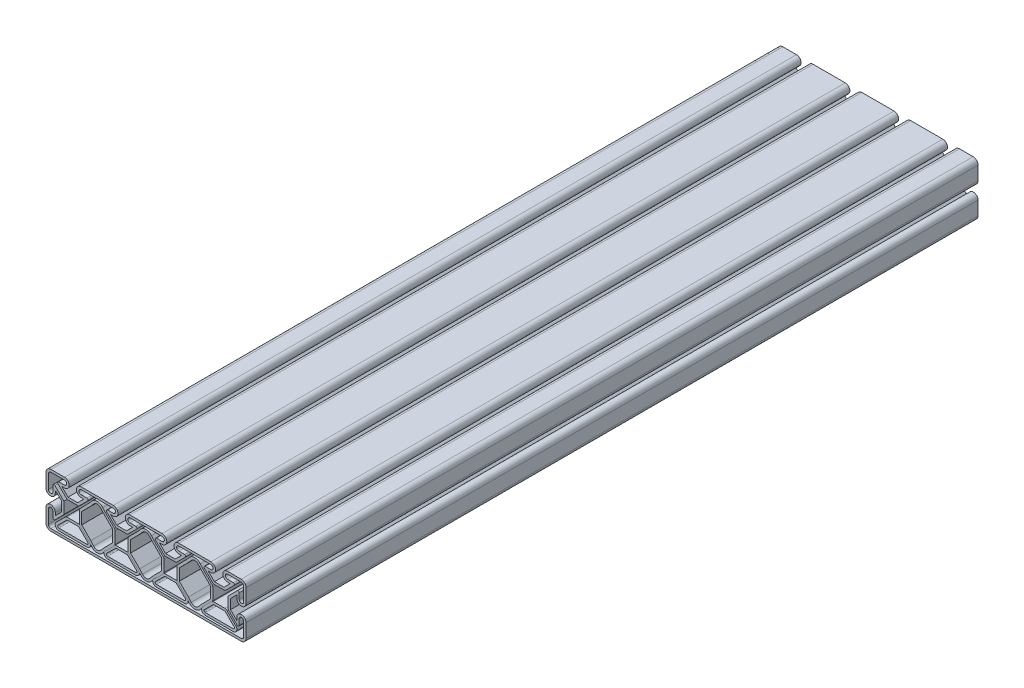
from build123d import *

# Parameters (mm, degrees)
EXTRUIR_L_MINA3_DEPTH   = 300
EXTRUIR_L_MINA3_2_DEPTH = 300
EXTRUIR_L_MINA3_3_DEPTH = 300
EXTRUIR_L_MINA3_4_DEPTH = 300
EXTRUIR_L_MINA3_5_DEPTH = 300
EXTRUIR_L_MINA3_6_DEPTH = 300
EXTRUIR_L_MINA3_7_DEPTH = 300
EXTRUIR_L_MINA3_8_DEPTH = 300


with BuildPart() as part:
    # Croquis1 → Extruir-Lámina3 (new body)
    with BuildSketch(Plane.XY.offset(50)):
        with BuildLine():
            Line((3.317284325, -6.768847378), (2.192426312, -8.056279027))
            ThreePointArc((2.192426312, -8.056279027), (-0.056796543, -9.115123728), (-2.284563012, -8.011850366))
            Line((-2.284563012, -8.011850366), (-3.391818467, -6.779379888))
            ThreePointArc((-3.391818467, -6.779379888), (-3.398431113, -6.772867398), (-3.405003337, -6.766314118))
            Line((-3.405003337, -6.766314118), (-7.166930022, -2.974891232))
            ThreePointArc((-7.166930022, -2.974891232), (-7.334651994, -2.659705848), (-7.392594033, -2.307405967))
            Line((-7.392594033, -2.307405967), (-7.392594033, 2.392594033))
            ThreePointArc((-7.392594033, 2.392594033), (-7.334651994, 2.744893913), (-7.166930022, 3.060079297))
            Line((-7.166930022, 3.060079297), (-3.405003337, 6.851502183))
            ThreePointArc((-3.405003337, 6.851502183), (-3.403738619, 6.852769568), (-3.40247239, 6.854035443))
            Line((-3.40247239, 6.854035443), (-2.277614377, 8.141467092))
            ThreePointArc((-2.277614377, 8.141467092), (-0.028391522, 9.200311794), (2.199374946, 8.097038431))
            Line((2.199374946, 8.097038431), (3.306630402, 6.864567953))
            ThreePointArc((3.306630402, 6.864567953), (3.313243048, 6.858055463), (3.319815271, 6.851502183))
            Line((3.319815271, 6.851502183), (7.081741956, 3.060079297))
            ThreePointArc((7.081741956, 3.060079297), (7.249463928, 2.744893913), (7.307405967, 2.392594033))
            Line((7.307405967, 2.392594033), (7.307405967, -2.307405967))
            ThreePointArc((7.307405967, -2.307405967), (7.249463928, -2.659705848), (7.081741956, -2.974891232))
            Line((7.081741956, -2.974891232), (3.319815271, -6.766314118))
            ThreePointArc((3.319815271, -6.766314118), (3.318550554, -6.767581503), (3.317284325, -6.768847378))
        make_face()
        with BuildLine():
            Line((2.592630975, -6.078383317), (1.425820625, -7.413830597))
            ThreePointArc((1.425820625, -7.413830597), (-0.054396167, -8.115083079), (-1.514441587, -7.372746117))
            Line((-1.514441587, -7.372746117), (-2.675150448, -6.080777405))
            ThreePointArc((-2.675150448, -6.080777405), (-2.685792015, -6.071019973), (-2.696147423, -6.060959358))
            Line((-2.696147423, -6.060959358), (-6.386563295, -2.341607982))
            ThreePointArc((-6.386563295, -2.341607982), (-6.391074808, -2.324770785), (-6.392594033, -2.307405967))
            Line((-6.392594033, -2.307405967), (-6.392594033, 2.392594033))
            ThreePointArc((-6.392594033, 2.392594033), (-6.391074808, 2.40995885), (-6.386563295, 2.426796047))
            Line((-6.386563295, 2.426796047), (-2.696147423, 6.146147423))
            ThreePointArc((-2.696147423, 6.146147423), (-2.687093407, 6.154975297), (-2.67781904, 6.163571383))
            Line((-2.67781904, 6.163571383), (-1.51100869, 7.499018663))
            ThreePointArc((-1.51100869, 7.499018663), (-0.030791898, 8.200271144), (1.429253522, 7.457934182))
            Line((1.429253522, 7.457934182), (2.589962383, 6.16596547))
            ThreePointArc((2.589962383, 6.16596547), (2.60060395, 6.156208038), (2.610959358, 6.146147423))
            Line((2.610959358, 6.146147423), (6.301375229, 2.426796047))
            ThreePointArc((6.301375229, 2.426796047), (6.305886743, 2.40995885), (6.307405967, 2.392594033))
            Line((6.307405967, 2.392594033), (6.307405967, -2.307405967))
            ThreePointArc((6.307405967, -2.307405967), (6.305886743, -2.324770785), (6.301375229, -2.341607982))
            Line((6.301375229, -2.341607982), (2.610959358, -6.060959358))
            ThreePointArc((2.610959358, -6.060959358), (2.601905342, -6.069787232), (2.592630975, -6.078383317))
        make_face(mode=Mode.SUBTRACT)
    extrude(amount=EXTRUIR_L_MINA3_DEPTH)


with BuildPart() as body_2:
    # Croquis1 → Extruir-L_mina3 2 (new body)
    with BuildSketch(Plane.XY.offset(50)):
        with BuildLine():
            Line((5.421326573, 7.242594033), (6.557405967, 7.242594033))
            ThreePointArc((6.557405967, 7.242594033), (8.457405967, 9.142594033), (6.557405967, 11.042594033))
            Line((6.557405967, 11.042594033), (-6.642594033, 11.042594033))
            ThreePointArc((-6.642594033, 11.042594033), (-8.542594033, 9.142594033), (-6.642594033, 7.242594033))
            Line((-6.642594033, 7.242594033), (-5.506514638, 7.242594033))
            Line((-5.506514638, 7.242594033), (-8.076837601, 4.692594033))
            Line((-8.076837601, 4.692594033), (-12.008350464, 4.692594033))
            Line((-12.008350464, 4.692594033), (-14.578673427, 7.242594033))
            Line((-14.578673427, 7.242594033), (-13.442594033, 7.242594033))
            ThreePointArc((-13.442594033, 7.242594033), (-11.542594033, 9.142594033), (-13.442594033, 11.042594033))
            Line((-13.442594033, 11.042594033), (-26.642594033, 11.042594033))
            ThreePointArc((-26.642594033, 11.042594033), (-28.542594033, 9.142594033), (-26.642594033, 7.242594033))
            Line((-26.642594033, 7.242594033), (-25.506514638, 7.242594033))
            Line((-25.506514638, 7.242594033), (-28.076837601, 4.692594033))
            Line((-28.076837601, 4.692594033), (-32.008350464, 4.692594033))
            Line((-32.008350464, 4.692594033), (-34.578673427, 7.242594033))
            Line((-34.578673427, 7.242594033), (-33.442594033, 7.242594033))
            ThreePointArc((-33.442594033, 7.242594033), (-31.542594033, 9.142594033), (-33.442594033, 11.042594033))
            Line((-33.442594033, 11.042594033), (-39.042594033, 11.042594033))
            ThreePointArc((-39.042594033, 11.042594033), (-40.456807595, 10.456807595), (-41.042594033, 9.042594033))
            Line((-41.042594033, 9.042594033), (-41.042594033, 3.442594033))
            ThreePointArc((-41.042594033, 3.442594033), (-39.142594033, 1.542594033), (-37.242594033, 3.442594033))
            Line((-37.242594033, 3.442594033), (-37.242594033, 4.578783956))
            Line((-37.242594033, 4.578783956), (-34.692594033, 2.008790129))
            Line((-34.692594033, 2.008790129), (-34.692594033, -1.923602064))
            Line((-34.692594033, -1.923602064), (-37.242594033, -4.493595891))
            Line((-37.242594033, -4.493595891), (-37.242594033, -3.357405967))
            ThreePointArc((-37.242594033, -3.357405967), (-39.142594033, -1.457405967), (-41.042594033, -3.357405967))
            Line((-41.042594033, -3.357405967), (-41.042594033, -8.957405967))
            ThreePointArc((-41.042594033, -8.957405967), (-40.456807595, -10.37161953), (-39.042594033, -10.957405967))
            Line((-39.042594033, -10.957405967), (-33.442594033, -10.957405967))
            Line((-33.442594033, -10.957405967), (-26.642594033, -10.957405967))
            Line((-26.642594033, -10.957405967), (-13.442594033, -10.957405967))
            Line((-13.442594033, -10.957405967), (-6.642594033, -10.957405967))
            Line((-6.642594033, -10.957405967), (6.557405967, -10.957405967))
            Line((6.557405967, -10.957405967), (13.357405967, -10.957405967))
            Line((13.357405967, -10.957405967), (26.557405967, -10.957405967))
            Line((26.557405967, -10.957405967), (33.357405967, -10.957405967))
            Line((33.357405967, -10.957405967), (38.957405967, -10.957405967))
            ThreePointArc((38.957405967, -10.957405967), (40.37161953, -10.37161953), (40.957405967, -8.957405967))
            Line((40.957405967, -8.957405967), (40.957405967, -3.357405967))
            ThreePointArc((40.957405967, -3.357405967), (39.057405967, -1.457405967), (37.157405967, -3.357405967))
            Line((37.157405967, -3.357405967), (37.157405967, -4.493595891))
            Line((37.157405967, -4.493595891), (34.607405967, -1.923602064))
            Line((34.607405967, -1.923602064), (34.607405967, 2.008790129))
            Line((34.607405967, 2.008790129), (37.157405967, 4.578783956))
            Line((37.157405967, 4.578783956), (37.157405967, 3.442594033))
            ThreePointArc((37.157405967, 3.442594033), (39.057405967, 1.542594033), (40.957405967, 3.442594033))
            Line((40.957405967, 3.442594033), (40.957405967, 9.042594033))
            ThreePointArc((40.957405967, 9.042594033), (40.37161953, 10.456807595), (38.957405967, 11.042594033))
            Line((38.957405967, 11.042594033), (33.357405967, 11.042594033))
            ThreePointArc((33.357405967, 11.042594033), (31.457405967, 9.142594033), (33.357405967, 7.242594033))
            Line((33.357405967, 7.242594033), (34.493485362, 7.242594033))
            Line((34.493485362, 7.242594033), (31.923162399, 4.692594033))
            Line((31.923162399, 4.692594033), (27.991649536, 4.692594033))
            Line((27.991649536, 4.692594033), (25.421326573, 7.242594033))
            Line((25.421326573, 7.242594033), (26.557405967, 7.242594033))
            ThreePointArc((26.557405967, 7.242594033), (28.457405967, 9.142594033), (26.557405967, 11.042594033))
            Line((26.557405967, 11.042594033), (13.357405967, 11.042594033))
            ThreePointArc((13.357405967, 11.042594033), (11.457405967, 9.142594033), (13.357405967, 7.242594033))
            Line((13.357405967, 7.242594033), (14.493485362, 7.242594033))
            Line((14.493485362, 7.242594033), (11.923162399, 4.692594033))
            Line((11.923162399, 4.692594033), (7.991649536, 4.692594033))
            Line((7.991649536, 4.692594033), (5.421326573, 7.242594033))
        make_face()
        with BuildLine():
            Line((4.207405967, 8.242594033), (6.557405967, 8.242594033))
            ThreePointArc((6.557405967, 8.242594033), (7.457405967, 9.142594033), (6.557405967, 10.042594033))
            Line((6.557405967, 10.042594033), (-6.642594033, 10.042594033))
            ThreePointArc((-6.642594033, 10.042594033), (-7.542594033, 9.142594033), (-6.642594033, 8.242594033))
            Line((-6.642594033, 8.242594033), (-4.292594033, 8.242594033))
            ThreePointArc((-4.292594033, 8.242594033), (-3.830654266, 7.933935749), (-3.939040642, 7.389040642))
            Line((-3.939040642, 7.389040642), (-7.598624771, 3.758392018))
            ThreePointArc((-7.598624771, 3.758392018), (-7.635236389, 3.710678828), (-7.692594033, 3.692594033))
            Line((-7.692594033, 3.692594033), (-12.392594033, 3.692594033))
            ThreePointArc((-12.392594033, 3.692594033), (-12.449951676, 3.710678828), (-12.486563295, 3.758392018))
            Line((-12.486563295, 3.758392018), (-16.146147423, 7.389040642))
            ThreePointArc((-16.146147423, 7.389040642), (-16.254533799, 7.933935749), (-15.792594033, 8.242594033))
            Line((-15.792594033, 8.242594033), (-13.442594033, 8.242594033))
            ThreePointArc((-13.442594033, 8.242594033), (-12.542594033, 9.142594033), (-13.442594033, 10.042594033))
            Line((-13.442594033, 10.042594033), (-26.642594033, 10.042594033))
            ThreePointArc((-26.642594033, 10.042594033), (-27.542594033, 9.142594033), (-26.642594033, 8.242594033))
            Line((-26.642594033, 8.242594033), (-24.292594033, 8.242594033))
            ThreePointArc((-24.292594033, 8.242594033), (-23.830654266, 7.933935749), (-23.939040642, 7.389040642))
            Line((-23.939040642, 7.389040642), (-27.598624771, 3.758392018))
            ThreePointArc((-27.598624771, 3.758392018), (-27.635236389, 3.710678828), (-27.692594033, 3.692594033))
            Line((-27.692594033, 3.692594033), (-32.392594033, 3.692594033))
            ThreePointArc((-32.392594033, 3.692594033), (-32.449951676, 3.710678828), (-32.486563295, 3.758392018))
            Line((-32.486563295, 3.758392018), (-36.146147423, 7.389040642))
            ThreePointArc((-36.146147423, 7.389040642), (-36.254533799, 7.933935749), (-35.792594033, 8.242594033))
            Line((-35.792594033, 8.242594033), (-33.442594033, 8.242594033))
            ThreePointArc((-33.442594033, 8.242594033), (-32.542594033, 9.142594033), (-33.442594033, 10.042594033))
            Line((-33.442594033, 10.042594033), (-39.042594033, 10.042594033))
            ThreePointArc((-39.042594033, 10.042594033), (-39.749700814, 9.749700814), (-40.042594033, 9.042594033))
            Line((-40.042594033, 9.042594033), (-40.042594033, 3.442594033))
            ThreePointArc((-40.042594033, 3.442594033), (-39.142594033, 2.542594033), (-38.242594033, 3.442594033))
            Line((-38.242594033, 3.442594033), (-38.242594033, 5.792594033))
            ThreePointArc((-38.242594033, 5.792594033), (-37.933935749, 6.254533799), (-37.389040642, 6.146147423))
            Line((-37.389040642, 6.146147423), (-33.698624771, 2.426796047))
            ThreePointArc((-33.698624771, 2.426796047), (-33.694113257, 2.40995885), (-33.692594033, 2.392594033))
            Line((-33.692594033, 2.392594033), (-33.692594033, -2.307405967))
            ThreePointArc((-33.692594033, -2.307405967), (-33.694113257, -2.324770785), (-33.698624771, -2.341607982))
            Line((-33.698624771, -2.341607982), (-37.389040642, -6.060959358))
            ThreePointArc((-37.389040642, -6.060959358), (-37.933935749, -6.169345734), (-38.242594033, -5.707405967))
            Line((-38.242594033, -5.707405967), (-38.242594033, -3.357405967))
            ThreePointArc((-38.242594033, -3.357405967), (-39.142594033, -2.457405967), (-40.042594033, -3.357405967))
            Line((-40.042594033, -3.357405967), (-40.042594033, -8.957405967))
            ThreePointArc((-40.042594033, -8.957405967), (-39.749700814, -9.664512749), (-39.042594033, -9.957405967))
            Line((-39.042594033, -9.957405967), (-33.442594033, -9.957405967))
            Line((-33.442594033, -9.957405967), (-26.642594033, -9.957405967))
            Line((-26.642594033, -9.957405967), (-13.442594033, -9.957405967))
            Line((-13.442594033, -9.957405967), (-6.642594033, -9.957405967))
            Line((-6.642594033, -9.957405967), (6.557405967, -9.957405967))
            Line((6.557405967, -9.957405967), (13.357405967, -9.957405967))
            Line((13.357405967, -9.957405967), (26.557405967, -9.957405967))
            Line((26.557405967, -9.957405967), (33.357405967, -9.957405967))
            Line((33.357405967, -9.957405967), (38.957405967, -9.957405967))
            ThreePointArc((38.957405967, -9.957405967), (39.664512749, -9.664512749), (39.957405967, -8.957405967))
            Line((39.957405967, -8.957405967), (39.957405967, -3.357405967))
            ThreePointArc((39.957405967, -3.357405967), (39.057405967, -2.457405967), (38.157405967, -3.357405967))
            Line((38.157405967, -3.357405967), (38.157405967, -5.707405967))
            ThreePointArc((38.157405967, -5.707405967), (37.848747684, -6.169345734), (37.303852577, -6.060959358))
            Line((37.303852577, -6.060959358), (33.613436705, -2.341607982))
            ThreePointArc((33.613436705, -2.341607982), (33.608925192, -2.324770785), (33.607405967, -2.307405967))
            Line((33.607405967, -2.307405967), (33.607405967, 2.392594033))
            ThreePointArc((33.607405967, 2.392594033), (33.608925192, 2.40995885), (33.613436705, 2.426796047))
            Line((33.613436705, 2.426796047), (37.303852577, 6.146147423))
            ThreePointArc((37.303852577, 6.146147423), (37.848747684, 6.254533799), (38.157405967, 5.792594033))
            Line((38.157405967, 5.792594033), (38.157405967, 3.442594033))
            ThreePointArc((38.157405967, 3.442594033), (39.057405967, 2.542594033), (39.957405967, 3.442594033))
            Line((39.957405967, 3.442594033), (39.957405967, 9.042594033))
            ThreePointArc((39.957405967, 9.042594033), (39.664512749, 9.749700814), (38.957405967, 10.042594033))
            Line((38.957405967, 10.042594033), (33.357405967, 10.042594033))
            ThreePointArc((33.357405967, 10.042594033), (32.457405967, 9.142594033), (33.357405967, 8.242594033))
            Line((33.357405967, 8.242594033), (35.707405967, 8.242594033))
            ThreePointArc((35.707405967, 8.242594033), (36.169345734, 7.933935749), (36.060959358, 7.389040642))
            Line((36.060959358, 7.389040642), (32.401375229, 3.758392018))
            ThreePointArc((32.401375229, 3.758392018), (32.364763611, 3.710678828), (32.307405967, 3.692594033))
            Line((32.307405967, 3.692594033), (27.607405967, 3.692594033))
            ThreePointArc((27.607405967, 3.692594033), (27.550048324, 3.710678828), (27.513436705, 3.758392018))
            Line((27.513436705, 3.758392018), (23.853852577, 7.389040642))
            ThreePointArc((23.853852577, 7.389040642), (23.745466201, 7.933935749), (24.207405967, 8.242594033))
            Line((24.207405967, 8.242594033), (26.557405967, 8.242594033))
            ThreePointArc((26.557405967, 8.242594033), (27.457405967, 9.142594033), (26.557405967, 10.042594033))
            Line((26.557405967, 10.042594033), (13.357405967, 10.042594033))
            ThreePointArc((13.357405967, 10.042594033), (12.457405967, 9.142594033), (13.357405967, 8.242594033))
            Line((13.357405967, 8.242594033), (15.707405967, 8.242594033))
            ThreePointArc((15.707405967, 8.242594033), (16.169345734, 7.933935749), (16.060959358, 7.389040642))
            Line((16.060959358, 7.389040642), (12.401375229, 3.758392018))
            ThreePointArc((12.401375229, 3.758392018), (12.364763611, 3.710678828), (12.307405967, 3.692594033))
            Line((12.307405967, 3.692594033), (7.607405967, 3.692594033))
            ThreePointArc((7.607405967, 3.692594033), (7.550048324, 3.710678828), (7.513436705, 3.758392018))
            Line((7.513436705, 3.758392018), (3.853852577, 7.389040642))
            ThreePointArc((3.853852577, 7.389040642), (3.745466201, 7.933935749), (4.207405967, 8.242594033))
        make_face(mode=Mode.SUBTRACT)
    extrude(amount=EXTRUIR_L_MINA3_2_DEPTH)


with BuildPart() as body_3:
    # Croquis1 → Extruir-L_mina3 3 (new body)
    with BuildSketch(Plane.XY.offset(50)):
        with BuildLine():
            Line((-24.292594033, -9.157405967), (-26.642594033, -9.157405967))
            Line((-26.642594033, -9.157405967), (-33.442594033, -9.157405967))
            Line((-33.442594033, -9.157405967), (-35.792594033, -9.157405967))
            ThreePointArc((-35.792594033, -9.157405967), (-37.178894314, -8.230268543), (-36.851473432, -6.594968008))
            Line((-36.851473432, -6.594968008), (-33.263211162, -3.035077316))
            ThreePointArc((-33.263211162, -3.035077316), (-32.877588097, -2.720096108), (-32.392594033, -2.607405967))
            Line((-32.392594033, -2.607405967), (-27.692594033, -2.607405967))
            ThreePointArc((-27.692594033, -2.607405967), (-27.207599969, -2.720096108), (-26.821976904, -3.035077316))
            Line((-26.821976904, -3.035077316), (-23.233714633, -6.594968008))
            ThreePointArc((-23.233714633, -6.594968008), (-22.906293751, -8.230268543), (-24.292594033, -9.157405967))
        make_face()
        with BuildLine():
            Line((-24.292594033, -8.157405967), (-26.642594033, -8.157405967))
            Line((-26.642594033, -8.157405967), (-33.442594033, -8.157405967))
            Line((-33.442594033, -8.157405967), (-35.792594033, -8.157405967))
            ThreePointArc((-35.792594033, -8.157405967), (-36.254533799, -7.848747684), (-36.146147423, -7.303852577))
            Line((-36.146147423, -7.303852577), (-32.486563295, -3.673203953))
            ThreePointArc((-32.486563295, -3.673203953), (-32.449951676, -3.625490763), (-32.392594033, -3.607405967))
            Line((-32.392594033, -3.607405967), (-27.692594033, -3.607405967))
            ThreePointArc((-27.692594033, -3.607405967), (-27.635236389, -3.625490763), (-27.598624771, -3.673203953))
            Line((-27.598624771, -3.673203953), (-23.939040642, -7.303852577))
            ThreePointArc((-23.939040642, -7.303852577), (-23.830654266, -7.848747684), (-24.292594033, -8.157405967))
        make_face(mode=Mode.SUBTRACT)
    extrude(amount=EXTRUIR_L_MINA3_3_DEPTH)


with BuildPart() as body_4:
    # Croquis1 → Extruir-L_mina3 4 (new body)
    with BuildSketch(Plane.XY.offset(50)):
        with BuildLine():
            Line((-4.292594033, -9.157405967), (-6.642594033, -9.157405967))
            Line((-6.642594033, -9.157405967), (-13.442594033, -9.157405967))
            Line((-13.442594033, -9.157405967), (-15.792594033, -9.157405967))
            ThreePointArc((-15.792594033, -9.157405967), (-17.178894314, -8.230268543), (-16.851473432, -6.594968008))
            Line((-16.851473432, -6.594968008), (-13.263211162, -3.035077316))
            ThreePointArc((-13.263211162, -3.035077316), (-12.877588097, -2.720096108), (-12.392594033, -2.607405967))
            Line((-12.392594033, -2.607405967), (-7.692594033, -2.607405967))
            ThreePointArc((-7.692594033, -2.607405967), (-7.207599969, -2.720096108), (-6.821976904, -3.035077316))
            Line((-6.821976904, -3.035077316), (-3.233714633, -6.594968008))
            ThreePointArc((-3.233714633, -6.594968008), (-2.906293751, -8.230268543), (-4.292594033, -9.157405967))
        make_face()
        with BuildLine():
            Line((-4.292594033, -8.157405967), (-6.642594033, -8.157405967))
            Line((-6.642594033, -8.157405967), (-13.442594033, -8.157405967))
            Line((-13.442594033, -8.157405967), (-15.792594033, -8.157405967))
            ThreePointArc((-15.792594033, -8.157405967), (-16.254533799, -7.848747684), (-16.146147423, -7.303852577))
            Line((-16.146147423, -7.303852577), (-12.486563295, -3.673203953))
            ThreePointArc((-12.486563295, -3.673203953), (-12.449951676, -3.625490763), (-12.392594033, -3.607405967))
            Line((-12.392594033, -3.607405967), (-7.692594033, -3.607405967))
            ThreePointArc((-7.692594033, -3.607405967), (-7.635236389, -3.625490763), (-7.598624771, -3.673203953))
            Line((-7.598624771, -3.673203953), (-3.939040642, -7.303852577))
            ThreePointArc((-3.939040642, -7.303852577), (-3.830654266, -7.848747684), (-4.292594033, -8.157405967))
        make_face(mode=Mode.SUBTRACT)
    extrude(amount=EXTRUIR_L_MINA3_4_DEPTH)


with BuildPart() as body_5:
    # Croquis1 → Extruir-L_mina3 5 (new body)
    with BuildSketch(Plane.XY.offset(50)):
        with BuildLine():
            Line((15.707405967, -9.157405967), (13.357405967, -9.157405967))
            Line((13.357405967, -9.157405967), (6.557405967, -9.157405967))
            Line((6.557405967, -9.157405967), (4.207405967, -9.157405967))
            ThreePointArc((4.207405967, -9.157405967), (2.821105686, -8.230268543), (3.148526568, -6.594968008))
            Line((3.148526568, -6.594968008), (6.736788838, -3.035077316))
            ThreePointArc((6.736788838, -3.035077316), (7.122411903, -2.720096108), (7.607405967, -2.607405967))
            Line((7.607405967, -2.607405967), (12.307405967, -2.607405967))
            ThreePointArc((12.307405967, -2.607405967), (12.792400031, -2.720096108), (13.178023096, -3.035077317))
            Line((13.178023096, -3.035077317), (16.766285367, -6.594968008))
            ThreePointArc((16.766285367, -6.594968008), (17.093706249, -8.230268543), (15.707405967, -9.157405967))
        make_face()
        with BuildLine():
            Line((15.707405967, -8.157405967), (13.357405967, -8.157405967))
            Line((13.357405967, -8.157405967), (6.557405967, -8.157405967))
            Line((6.557405967, -8.157405967), (4.207405967, -8.157405967))
            ThreePointArc((4.207405967, -8.157405967), (3.745466201, -7.848747684), (3.853852577, -7.303852577))
            Line((3.853852577, -7.303852577), (7.513436705, -3.673203953))
            ThreePointArc((7.513436705, -3.673203953), (7.550048324, -3.625490763), (7.607405967, -3.607405967))
            Line((7.607405967, -3.607405967), (12.307405967, -3.607405967))
            ThreePointArc((12.307405967, -3.607405967), (12.364763611, -3.625490763), (12.401375229, -3.673203953))
            Line((12.401375229, -3.673203953), (16.060959358, -7.303852577))
            ThreePointArc((16.060959358, -7.303852577), (16.169345734, -7.848747684), (15.707405967, -8.157405967))
        make_face(mode=Mode.SUBTRACT)
    extrude(amount=EXTRUIR_L_MINA3_5_DEPTH)


with BuildPart() as body_6:
    # Croquis1 → Extruir-L_mina3 6 (new body)
    with BuildSketch(Plane.XY.offset(50)):
        with BuildLine():
            Line((35.707405967, -9.157405967), (33.357405967, -9.157405967))
            Line((33.357405967, -9.157405967), (26.557405967, -9.157405967))
            Line((26.557405967, -9.157405967), (24.207405967, -9.157405967))
            ThreePointArc((24.207405967, -9.157405967), (22.821105686, -8.230268543), (23.148526568, -6.594968008))
            Line((23.148526568, -6.594968008), (26.736788838, -3.035077316))
            ThreePointArc((26.736788838, -3.035077316), (27.122411903, -2.720096108), (27.607405967, -2.607405967))
            Line((27.607405967, -2.607405967), (32.307405967, -2.607405967))
            ThreePointArc((32.307405967, -2.607405967), (32.792400031, -2.720096108), (33.178023096, -3.035077316))
            Line((33.178023096, -3.035077316), (36.766285367, -6.594968008))
            ThreePointArc((36.766285367, -6.594968008), (37.093706249, -8.230268543), (35.707405967, -9.157405967))
        make_face()
        with BuildLine():
            Line((35.707405967, -8.157405967), (33.357405967, -8.157405967))
            Line((33.357405967, -8.157405967), (26.557405967, -8.157405967))
            Line((26.557405967, -8.157405967), (24.207405967, -8.157405967))
            ThreePointArc((24.207405967, -8.157405967), (23.745466201, -7.848747684), (23.853852577, -7.303852577))
            Line((23.853852577, -7.303852577), (27.513436705, -3.673203953))
            ThreePointArc((27.513436705, -3.673203953), (27.550048324, -3.625490763), (27.607405967, -3.607405967))
            Line((27.607405967, -3.607405967), (32.307405967, -3.607405967))
            ThreePointArc((32.307405967, -3.607405967), (32.364763611, -3.625490763), (32.401375229, -3.673203953))
            Line((32.401375229, -3.673203953), (36.060959358, -7.303852577))
            ThreePointArc((36.060959358, -7.303852577), (36.169345734, -7.848747684), (35.707405967, -8.157405967))
        make_face(mode=Mode.SUBTRACT)
    extrude(amount=EXTRUIR_L_MINA3_6_DEPTH)


with BuildPart() as body_7:
    # Croquis1 → Extruir-L_mina3 7 (new body)
    with BuildSketch(Plane.XY.offset(50)):
        with BuildLine():
            Line((-16.682715675, -6.768847378), (-17.807573688, -8.056279027))
            ThreePointArc((-17.807573688, -8.056279027), (-20.056796543, -9.115123728), (-22.284563012, -8.011850366))
            Line((-22.284563012, -8.011850366), (-23.391818467, -6.779379888))
            ThreePointArc((-23.391818467, -6.779379888), (-23.398431112, -6.772867398), (-23.405003336, -6.766314119))
            Line((-23.405003336, -6.766314119), (-27.166930022, -2.974891232))
            ThreePointArc((-27.166930022, -2.974891232), (-27.334651994, -2.659705848), (-27.392594033, -2.307405967))
            Line((-27.392594033, -2.307405967), (-27.392594033, 2.392594033))
            ThreePointArc((-27.392594033, 2.392594033), (-27.334651994, 2.744893913), (-27.166930022, 3.060079297))
            Line((-27.166930022, 3.060079297), (-23.405003337, 6.851502183))
            ThreePointArc((-23.405003337, 6.851502183), (-23.403738619, 6.852769568), (-23.40247239, 6.854035443))
            Line((-23.40247239, 6.854035443), (-22.277614377, 8.141467092))
            ThreePointArc((-22.277614377, 8.141467092), (-20.028391522, 9.200311794), (-17.800625054, 8.097038431))
            Line((-17.800625054, 8.097038431), (-16.693369598, 6.864567953))
            ThreePointArc((-16.693369598, 6.864567953), (-16.686756952, 6.858055463), (-16.680184728, 6.851502182))
            Line((-16.680184728, 6.851502182), (-12.918258044, 3.060079297))
            ThreePointArc((-12.918258044, 3.060079297), (-12.750536072, 2.744893913), (-12.692594033, 2.392594033))
            Line((-12.692594033, 2.392594033), (-12.692594033, -2.307405967))
            ThreePointArc((-12.692594033, -2.307405967), (-12.750536072, -2.659705848), (-12.918258044, -2.974891232))
            Line((-12.918258044, -2.974891232), (-16.680184729, -6.766314118))
            ThreePointArc((-16.680184729, -6.766314118), (-16.681449446, -6.767581503), (-16.682715675, -6.768847378))
        make_face()
        with BuildLine():
            Line((-17.407369025, -6.078383317), (-18.574179375, -7.413830597))
            ThreePointArc((-18.574179375, -7.413830597), (-20.054396167, -8.115083079), (-21.514441587, -7.372746117))
            Line((-21.514441587, -7.372746117), (-22.675150448, -6.080777405))
            ThreePointArc((-22.675150448, -6.080777405), (-22.685792015, -6.071019973), (-22.696147423, -6.060959358))
            Line((-22.696147423, -6.060959358), (-26.386563295, -2.341607982))
            ThreePointArc((-26.386563295, -2.341607982), (-26.391074808, -2.324770785), (-26.392594033, -2.307405967))
            Line((-26.392594033, -2.307405967), (-26.392594033, 2.392594033))
            ThreePointArc((-26.392594033, 2.392594033), (-26.391074808, 2.40995885), (-26.386563295, 2.426796047))
            Line((-26.386563295, 2.426796047), (-22.696147423, 6.146147423))
            ThreePointArc((-22.696147423, 6.146147423), (-22.687093407, 6.154975297), (-22.67781904, 6.163571383))
            Line((-22.67781904, 6.163571383), (-21.51100869, 7.499018663))
            ThreePointArc((-21.51100869, 7.499018663), (-20.030791898, 8.200271144), (-18.570746478, 7.457934182))
            Line((-18.570746478, 7.457934182), (-17.410037617, 6.16596547))
            ThreePointArc((-17.410037617, 6.16596547), (-17.39939605, 6.156208038), (-17.389040642, 6.146147423))
            Line((-17.389040642, 6.146147423), (-13.698624771, 2.426796047))
            ThreePointArc((-13.698624771, 2.426796047), (-13.694113257, 2.40995885), (-13.692594033, 2.392594033))
            Line((-13.692594033, 2.392594033), (-13.692594033, -2.307405967))
            ThreePointArc((-13.692594033, -2.307405967), (-13.694113257, -2.324770785), (-13.698624771, -2.341607982))
            Line((-13.698624771, -2.341607982), (-17.389040642, -6.060959358))
            ThreePointArc((-17.389040642, -6.060959358), (-17.398094658, -6.069787232), (-17.407369025, -6.078383317))
        make_face(mode=Mode.SUBTRACT)
    extrude(amount=EXTRUIR_L_MINA3_7_DEPTH)


with BuildPart() as body_8:
    # Croquis1 → Extruir-L_mina3 8 (new body)
    with BuildSketch(Plane.XY.offset(50)):
        with BuildLine():
            Line((16.59752761, 6.854035443), (17.722385623, 8.141467092))
            ThreePointArc((17.722385623, 8.141467092), (19.971608478, 9.200311794), (22.199374946, 8.097038431))
            Line((22.199374946, 8.097038431), (23.306630402, 6.864567953))
            ThreePointArc((23.306630402, 6.864567953), (23.313243049, 6.858055462), (23.319815274, 6.85150218))
            Line((23.319815274, 6.85150218), (27.081741956, 3.060079297))
            ThreePointArc((27.081741956, 3.060079297), (27.249463928, 2.744893913), (27.307405967, 2.392594033))
            Line((27.307405967, 2.392594033), (27.307405967, -2.307405967))
            ThreePointArc((27.307405967, -2.307405967), (27.249463928, -2.659705848), (27.081741956, -2.974891232))
            Line((27.081741956, -2.974891232), (23.319815272, -6.766314118))
            ThreePointArc((23.319815272, -6.766314118), (23.318550554, -6.767581503), (23.317284325, -6.768847378))
            Line((23.317284325, -6.768847378), (22.192426312, -8.056279027))
            ThreePointArc((22.192426312, -8.056279027), (19.943203457, -9.115123728), (17.715436988, -8.011850366))
            Line((17.715436988, -8.011850366), (16.608181533, -6.779379888))
            ThreePointArc((16.608181533, -6.779379888), (16.601568888, -6.772867398), (16.594996664, -6.766314118))
            Line((16.594996664, -6.766314118), (12.833069978, -2.974891232))
            ThreePointArc((12.833069978, -2.974891232), (12.665348006, -2.659705848), (12.607405967, -2.307405967))
            Line((12.607405967, -2.307405967), (12.607405967, 2.392594033))
            ThreePointArc((12.607405967, 2.392594033), (12.665348006, 2.744893913), (12.833069978, 3.060079297))
            Line((12.833069978, 3.060079297), (16.594996663, 6.851502183))
            ThreePointArc((16.594996663, 6.851502183), (16.596261381, 6.852769568), (16.59752761, 6.854035443))
        make_face()
        with BuildLine():
            Line((17.32218096, 6.163571383), (18.48899131, 7.499018663))
            ThreePointArc((18.48899131, 7.499018663), (19.969208102, 8.200271144), (21.429253522, 7.457934182))
            Line((21.429253522, 7.457934182), (22.589962383, 6.16596547))
            ThreePointArc((22.589962383, 6.16596547), (22.60060395, 6.156208038), (22.610959358, 6.146147423))
            Line((22.610959358, 6.146147423), (26.301375229, 2.426796047))
            ThreePointArc((26.301375229, 2.426796047), (26.305886743, 2.40995885), (26.307405967, 2.392594033))
            Line((26.307405967, 2.392594033), (26.307405967, -2.307405967))
            ThreePointArc((26.307405967, -2.307405967), (26.305886743, -2.324770785), (26.301375229, -2.341607982))
            Line((26.301375229, -2.341607982), (22.610959358, -6.060959358))
            ThreePointArc((22.610959358, -6.060959358), (22.601905342, -6.069787232), (22.592630975, -6.078383317))
            Line((22.592630975, -6.078383317), (21.425820625, -7.413830597))
            ThreePointArc((21.425820625, -7.413830597), (19.945603833, -8.115083079), (18.485558413, -7.372746117))
            Line((18.485558413, -7.372746117), (17.324849552, -6.080777405))
            ThreePointArc((17.324849552, -6.080777405), (17.314207985, -6.071019973), (17.303852577, -6.060959358))
            Line((17.303852577, -6.060959358), (13.613436705, -2.341607982))
            ThreePointArc((13.613436705, -2.341607982), (13.608925192, -2.324770785), (13.607405967, -2.307405967))
            Line((13.607405967, -2.307405967), (13.607405967, 2.392594033))
            ThreePointArc((13.607405967, 2.392594033), (13.608925192, 2.40995885), (13.613436705, 2.426796047))
            Line((13.613436705, 2.426796047), (17.303852577, 6.146147423))
            ThreePointArc((17.303852577, 6.146147423), (17.312906593, 6.154975297), (17.32218096, 6.163571383))
        make_face(mode=Mode.SUBTRACT)
    extrude(amount=EXTRUIR_L_MINA3_8_DEPTH)


solid = Compound([part.part, body_2.part, body_3.part, body_4.part, body_5.part, body_6.part, body_7.part, body_8.part])
